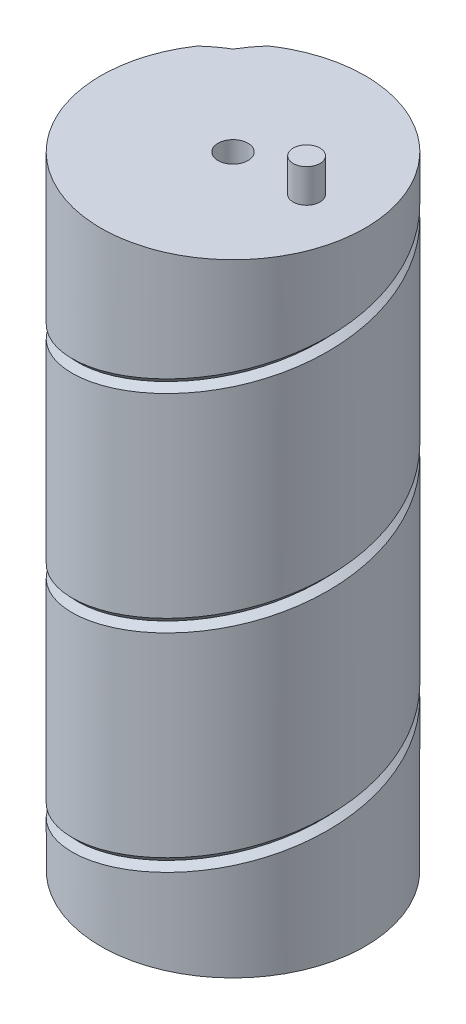
from build123d import *

# Parameters (mm, degrees)
SKETCH1_2_R                  = 19.75
EXTRUDE_MAIN_BODY_DEPTH      = 93
CUT_ANTENNA_WIRE_GUIDE_PITCH = 31
SKETCH28_R                   = 2
EXTRUDED_PEG_DEPTH           = 5
HOLE_FOR_THREADED_ROD_D      = 4.4958
SKETCH31_R                   = 2.25
CUT_PEG_DEPTH                = 5.5
CUT_EXTRUDE1_DEPTH           = 26.67


with BuildPart() as part:
    # Sketch1<2> → Extrude - Main Body (new body)
    with BuildSketch(Plane(origin=(0, 0, 0), x_dir=(1, 0, 0), z_dir=(0, 1, 0))):
        with Locations(Location((0, 0, 0), (0, 0, 90))):
            Circle(SKETCH1_2_R)
    extrude(amount=EXTRUDE_MAIN_BODY_DEPTH)

    # Cut - Antenna Wire Guide: arcs per turn and ends read off the stored shape
    # Cut - Antenna Wire Guide: the profile of Sketch15 screwed along a right-hand helix through 4.5 turns, 24 arcs to a turn; built about Z, then put on its axis
    cut_antenna_wire_guide_z = Axis((0, 0, 0), (0, 0, 1))
    cut_antenna_wire_guide_corners = [(19.75, 0, -31), (19.75, 0.222791045, -31.891831907), (18.830761184, 0, -31), (19.75, -0.222791045, -30.108168093)]
    with BuildLine(mode=Mode.PRIVATE) as cut_antenna_wire_guide_profile:
        Line(cut_antenna_wire_guide_corners[0], cut_antenna_wire_guide_corners[1])
        Line(cut_antenna_wire_guide_corners[1], cut_antenna_wire_guide_corners[2])
        Line(cut_antenna_wire_guide_corners[2], cut_antenna_wire_guide_corners[3])
        Line(cut_antenna_wire_guide_corners[3], cut_antenna_wire_guide_corners[0])
    cut_antenna_wire_guide_cap = Face(cut_antenna_wire_guide_profile.wire())
    cut_antenna_wire_guide_turn_angles = [0, 7.5, 15, 22.5, 30, 37.5, 45, 52.5, 60, 67.5, 75, 82.5, 90, 97.5, 105, 112.5, 120, 127.5, 135, 142.5, 150, 157.5, 165, 172.5, 180, 187.5, 195, 202.5, 210, 217.5, 225, 232.5, 240, 247.5, 255, 262.5, 270, 277.5, 285, 292.5, 300, 307.5, 315, 322.5, 330, 337.5, 345, 352.5, 360]
    cut_antenna_wire_guide_turn_weights = [1, 0.9914448613738104, 1, 0.9914448613738104, 1, 0.9914448613738104, 1, 0.9914448613738104, 1, 0.9914448613738104, 1, 0.9914448613738104, 1, 0.9914448613738104, 1, 0.9914448613738104, 1, 0.9914448613738104, 1, 0.9914448613738104, 1, 0.9914448613738104, 1, 0.9914448613738104, 1, 0.9914448613738104, 1, 0.9914448613738104, 1, 0.9914448613738104, 1, 0.9914448613738104, 1, 0.9914448613738104, 1, 0.9914448613738104, 1, 0.9914448613738104, 1, 0.9914448613738104, 1, 0.9914448613738104, 1, 0.9914448613738104, 1, 0.9914448613738104, 1, 0.9914448613738104, 1]
    cut_antenna_wire_guide_turn_rails = [Edge.make_bspline([Vector(p[0], p[1], 0).rotate(cut_antenna_wire_guide_z, cut_antenna_wire_guide_turn_angles[k]) / cut_antenna_wire_guide_turn_weights[k] + Vector(0, 0, p[2] + CUT_ANTENNA_WIRE_GUIDE_PITCH * cut_antenna_wire_guide_turn_angles[k] / 360) for k in range(49)], [0, 0, 0, 1, 1, 2, 2, 3, 3, 4, 4, 5, 5, 6, 6, 7, 7, 8, 8, 9, 9, 10, 10, 11, 11, 12, 12, 13, 13, 14, 14, 15, 15, 16, 16, 17, 17, 18, 18, 19, 19, 20, 20, 21, 21, 22, 22, 23, 23, 24, 24, 24], 2, cut_antenna_wire_guide_turn_weights) for p in cut_antenna_wire_guide_corners]
    cut_antenna_wire_guide_turn_sides = [Face.make_surface_from_curves(cut_antenna_wire_guide_turn_rails[p[0]], cut_antenna_wire_guide_turn_rails[p[1]]) for p in [(0, 1), (1, 2), (2, 3), (3, 0)]]
    cut_antenna_wire_guide_last_angles = [1440, 1447.5, 1455, 1462.5, 1470, 1477.5, 1485, 1492.5, 1500, 1507.5, 1515, 1522.5, 1530, 1537.5, 1545, 1552.5, 1560, 1567.5, 1575, 1582.5, 1590, 1597.5, 1605, 1612.5, 1620]
    cut_antenna_wire_guide_last_weights = [1, 0.9914448613738104, 1, 0.9914448613738104, 1, 0.9914448613738104, 1, 0.9914448613738104, 1, 0.9914448613738104, 1, 0.9914448613738104, 1, 0.9914448613738104, 1, 0.9914448613738104, 1, 0.9914448613738104, 1, 0.9914448613738104, 1, 0.9914448613738104, 1, 0.9914448613738104, 1]
    cut_antenna_wire_guide_last_rails = [Edge.make_bspline([Vector(p[0], p[1], 0).rotate(cut_antenna_wire_guide_z, cut_antenna_wire_guide_last_angles[k]) / cut_antenna_wire_guide_last_weights[k] + Vector(0, 0, p[2] + CUT_ANTENNA_WIRE_GUIDE_PITCH * cut_antenna_wire_guide_last_angles[k] / 360) for k in range(25)], [0, 0, 0, 1, 1, 2, 2, 3, 3, 4, 4, 5, 5, 6, 6, 7, 7, 8, 8, 9, 9, 10, 10, 11, 11, 12, 12, 12], 2, cut_antenna_wire_guide_last_weights) for p in cut_antenna_wire_guide_corners]
    cut_antenna_wire_guide_last_sides = [Face.make_surface_from_curves(cut_antenna_wire_guide_last_rails[p[0]], cut_antenna_wire_guide_last_rails[p[1]]) for p in [(0, 1), (1, 2), (2, 3), (3, 0)]]
    cut_antenna_wire_guide = Plane(origin=(0, 0, 0), x_dir=(-0.7071067811865537, 0, -0.7071067811865414), z_dir=(0, 1, 0)) * Solid(Shell([*[p.moved(Location((0, 0, CUT_ANTENNA_WIRE_GUIDE_PITCH * i))) for i in range(4) for p in cut_antenna_wire_guide_turn_sides], *cut_antenna_wire_guide_last_sides, cut_antenna_wire_guide_cap, cut_antenna_wire_guide_cap.rotate(cut_antenna_wire_guide_z, 1620).moved(Location((0, 0, CUT_ANTENNA_WIRE_GUIDE_PITCH * 1620 / 360)))]))
    add(cut_antenna_wire_guide, mode=Mode.SUBTRACT)

    # Sketch28 → Extruded Peg (add)
    with BuildSketch(Plane(origin=(0, 93, 0), x_dir=(1, 0, 0), z_dir=(0, 1, 0))):
        with Locations(Location((11, 0, 0), (0, 0, 270))):
            Circle(SKETCH28_R)
    extrude(amount=EXTRUDED_PEG_DEPTH)

    # Hole for Threaded Rod (through all)
    with Locations(Plane(origin=(0, 93, 0), x_dir=(1, 0, 0), z_dir=(0, 1, 0))):
        with Locations((0, 0)):
            Hole(HOLE_FOR_THREADED_ROD_D / 2)

    # Sketch31 → Cut Peg (cut)
    with BuildSketch(Plane.XZ):
        with Locations(Location((11, 0, 0), (0, 0, 270))):
            Circle(SKETCH31_R)
    extrude(amount=-CUT_PEG_DEPTH, mode=Mode.SUBTRACT)

    # Sketch32 → Cut-Extrude1 (cut)
    with BuildSketch(Plane.XZ):
        Polygon((2.199704526, 3.81), (-2.199704526, 3.81), (-4.399409051, 0), (-2.199704526, -3.81), (2.199704526, -3.81), (4.399409051, 0), align=None)
    extrude(amount=-CUT_EXTRUDE1_DEPTH, mode=Mode.SUBTRACT)


solid = part.part
